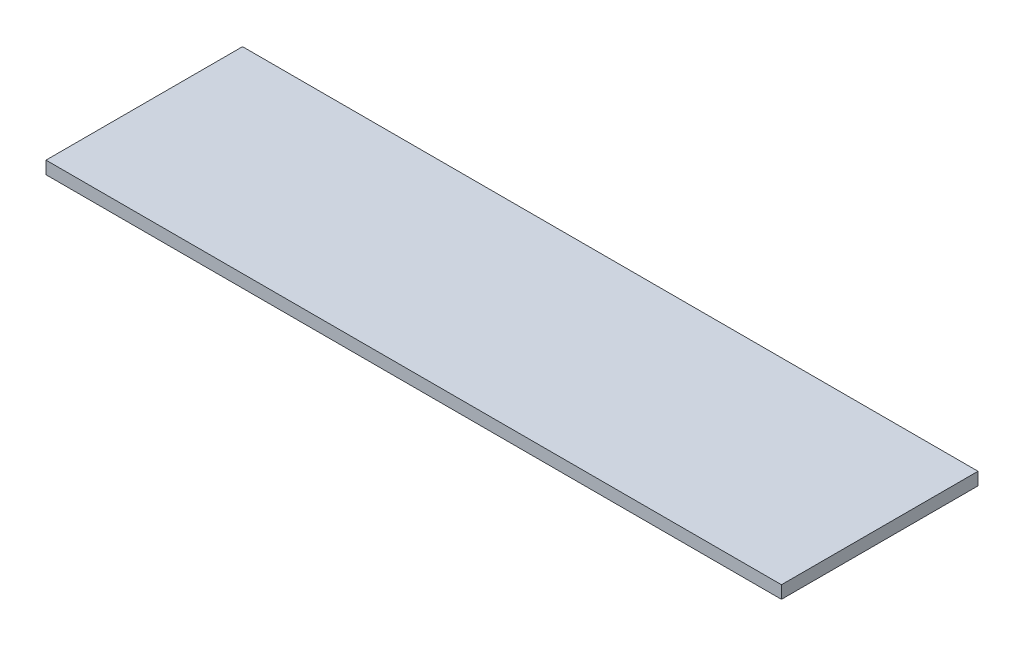
from build123d import *

# Parameters (mm, degrees)
ESQUISSE1_W        = 580
ESQUISSE1_H        = 155
BOSS_EXTRU_1_DEPTH = 10


with BuildPart() as part:
    # Esquisse1 → Boss.-Extru.1 (new body)
    with BuildSketch(Plane(origin=(0, 0, 0), x_dir=(1, 0, 0), z_dir=(0, 1, 0))):
        with Locations((290, 77.5)):
            Rectangle(ESQUISSE1_W, ESQUISSE1_H)
    extrude(amount=BOSS_EXTRU_1_DEPTH)


solid = part.part
